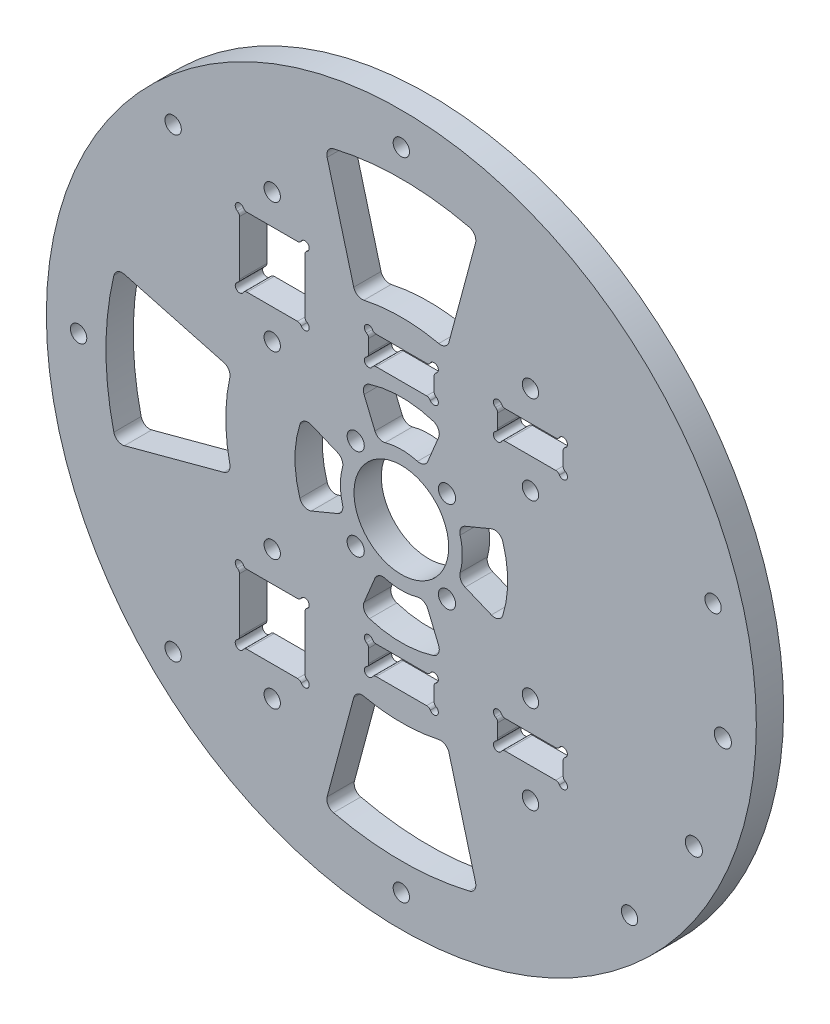
from build123d import *

# Parameters (mm, degrees)
SKETCH1_R                = 82.5
SKETCH1_R_2              = 1.89865
SKETCH1_R_3              = 1.9939
SKETCH1_R_4              = 11
BOSS_EXTRUDE1_DEPTH      = 6.35
SKETCH5_W                = 15.2
SKETCH5_H                = 16.075
CUT_EXTRUDE4_DEPTH       = 117.845293016
SKETCH6_R                = 1
CUT_EXTRUDE5_DEPTH       = 117.845293016
FILLET1_R                = 1
SKETCH10_W               = 52.512742007
SKETCH10_H               = 39.376351637
SKETCH10_W_2             = 54.285324016
SKETCH10_H_2             = 41.487938284
BOSS_EXTRUDE2_DEPTH      = 6.35
SKETCH11_W               = 15.2
SKETCH11_H               = 6.55
CUT_EXTRUDE8_DEPTH       = 117.845293016
SKETCH13_R               = 1
CUT_EXTRUDE9_DEPTH       = 117.845293016
FILLET2_R                = 1
LPATTERN3_COUNT          = 2
LPATTERN3_PITCH          = 30
FILLET2_OF_LPATTERN3_R   = 1
MIRROR3_DEPTH            = 6.35
SKETCH14_R               = 1.89865
CUT_EXTRUDE10_DEPTH      = 117.845293016
CUT_EXTRUDE11_DEPTH      = 10
FILLET3_R                = 2
CIRPATTERN1_COUNT        = 4
FILLET3_OF_CIRPATTERN1_R = 2
CUT_EXTRUDE12_DEPTH      = 117.845293016
FILLET4_R                = 2
CIRPATTERN2_COUNT        = 4
FILLET4_OF_CIRPATTERN2_R = 2
CUT_EXTRUDE13_START      = -3.571875
SKETCH17_R               = 4.7625
SKETCH17_R_2             = 1.89865
CUT_EXTRUDE13_DEPTH      = 3.571875


# Read off the part's stored shape, not the designer's step: Mirror3
with BuildPart() as part:
    # Sketch1 → Boss-Extrude1 (new body)
    with BuildSketch(Plane.XY):
        Circle(SKETCH1_R)
        with Locations((72.444436972, 19.411428383)):
            Circle(SKETCH1_R_2, mode=Mode.SUBTRACT)
        with Locations((74.714602357, -6.536680706)):
            Circle(SKETCH1_R_3, mode=Mode.SUBTRACT)
        Circle(SKETCH1_R_4, mode=Mode.SUBTRACT)
        with Locations((67.973084028, -31.696369631)):
            Circle(SKETCH1_R_3, mode=Mode.SUBTRACT)
        with Locations((10.606601718, -10.606601718)):
            Circle(SKETCH1_R_3, mode=Mode.SUBTRACT)
        with Locations((0, -75)):
            Circle(SKETCH1_R_2, mode=Mode.SUBTRACT)
        with Locations((-10.606601718, -10.606601718)):
            Circle(SKETCH1_R_3, mode=Mode.SUBTRACT)
        with Locations((-10.606601718, 10.606601718)):
            Circle(SKETCH1_R_3, mode=Mode.SUBTRACT)
        with Locations((10.606601718, 10.606601718)):
            Circle(SKETCH1_R_3, mode=Mode.SUBTRACT)
        with Locations((-53.033008589, -53.033008589)):
            Circle(SKETCH1_R_2, mode=Mode.SUBTRACT)
        with Locations((-75, 0)):
            Circle(SKETCH1_R_2, mode=Mode.SUBTRACT)
        with Locations((-53.033008589, 53.033008589)):
            Circle(SKETCH1_R_2, mode=Mode.SUBTRACT)
        with Locations((0, 75)):
            Circle(SKETCH1_R_2, mode=Mode.SUBTRACT)
        with Locations((53.033008589, -53.033008589)):
            Circle(SKETCH1_R_2, mode=Mode.SUBTRACT)
    extrude(amount=BOSS_EXTRUDE1_DEPTH)

    # Sketch5 → Cut-Extrude4 (cut, through all)
    with BuildSketch(Plane.XY.offset(6.35)):
        with Locations((-30, -35.9375)):
            Rectangle(SKETCH5_W, SKETCH5_H)
        with Locations((-30, 35.9375)):
            Rectangle(SKETCH5_W, SKETCH5_H)
        with Locations((30, 35.9375)):
            Rectangle(SKETCH5_W, SKETCH5_H)
        with Locations((0, -35.9375)):
            Rectangle(SKETCH5_W, SKETCH5_H)
        with Locations((30, -35.9375)):
            Rectangle(SKETCH5_W, SKETCH5_H)
        with Locations((0, 35.9375)):
            Rectangle(SKETCH5_W, SKETCH5_H)
    extrude(amount=-CUT_EXTRUDE4_DEPTH, mode=Mode.SUBTRACT)

    # Sketch6 → Cut-Extrude5 (cut, through all)
    with BuildSketch(Plane.XY.offset(6.35)):
        with Locations((-37.6, 43.975)):
            Circle(SKETCH6_R)
        with Locations((-22.4, 43.975)):
            Circle(SKETCH6_R)
        with Locations((-37.6, 27.9)):
            Circle(SKETCH6_R)
        with Locations((-22.4, 27.9)):
            Circle(SKETCH6_R)
        with Locations((-7.6, 43.975)):
            Circle(SKETCH6_R)
        with Locations((7.6, 43.975)):
            Circle(SKETCH6_R)
        with Locations((-7.6, 27.9)):
            Circle(SKETCH6_R)
        with Locations((7.6, 27.9)):
            Circle(SKETCH6_R)
        with Locations((22.4, 43.975)):
            Circle(SKETCH6_R)
        with Locations((37.6, 43.975)):
            Circle(SKETCH6_R)
        with Locations((22.4, 27.9)):
            Circle(SKETCH6_R)
        with Locations((37.6, 27.9)):
            Circle(SKETCH6_R)
        with Locations((-37.6, -27.9)):
            Circle(SKETCH6_R)
        with Locations((-22.4, -27.9)):
            Circle(SKETCH6_R)
        with Locations((-37.6, -43.975)):
            Circle(SKETCH6_R)
        with Locations((-22.4, -43.975)):
            Circle(SKETCH6_R)
        with Locations((-7.6, -27.9)):
            Circle(SKETCH6_R)
        with Locations((7.6, -27.9)):
            Circle(SKETCH6_R)
        with Locations((-7.6, -43.975)):
            Circle(SKETCH6_R)
        with Locations((7.6, -43.975)):
            Circle(SKETCH6_R)
        with Locations((22.4, -27.9)):
            Circle(SKETCH6_R)
        with Locations((37.6, -27.9)):
            Circle(SKETCH6_R)
        with Locations((22.4, -43.975)):
            Circle(SKETCH6_R)
        with Locations((37.6, -43.975)):
            Circle(SKETCH6_R)
    extrude(amount=-CUT_EXTRUDE5_DEPTH, mode=Mode.SUBTRACT)

    # Fillet1
    fillet1_edges = [part.edges().sort_by_distance(p)[0] for p in [
        (-37.6, 42.975, 3.175),
        (-36.6, 43.975, 3.175),
        (-22.4, 42.975, 3.175),
        (-23.4, 43.975, 3.175),
        (-37.6, 28.9, 3.175),
        (-36.6, 27.9, 3.175),
        (-23.4, 27.9, 3.175),
        (-22.4, 28.9, 3.175),
        (-7.6, 42.975, 3.175),
        (-6.6, 43.975, 3.175),
        (7.6, 42.975, 3.175),
        (6.6, 43.975, 3.175),
        (-7.6, 28.9, 3.175),
        (-6.6, 27.9, 3.175),
        (6.6, 27.9, 3.175),
        (7.6, 28.9, 3.175),
        (22.4, 42.975, 3.175),
        (23.4, 43.975, 3.175),
        (37.6, 42.975, 3.175),
        (36.6, 43.975, 3.175),
        (22.4, 28.9, 3.175),
        (23.4, 27.9, 3.175),
        (36.6, 27.9, 3.175),
        (37.6, 28.9, 3.175),
        (-36.6, -27.9, 3.175),
        (-37.6, -28.9, 3.175),
        (-22.4, -28.9, 3.175),
        (-23.4, -27.9, 3.175),
        (-36.6, -43.975, 3.175),
        (-37.6, -42.975, 3.175),
        (-23.4, -43.975, 3.175),
        (-22.4, -42.975, 3.175),
        (-6.6, -27.9, 3.175),
        (-7.6, -28.9, 3.175),
        (7.6, -28.9, 3.175),
        (6.6, -27.9, 3.175),
        (-6.6, -43.975, 3.175),
        (-7.6, -42.975, 3.175),
        (6.6, -43.975, 3.175),
        (7.6, -42.975, 3.175),
        (23.4, -27.9, 3.175),
        (22.4, -28.9, 3.175),
        (37.6, -28.9, 3.175),
        (36.6, -27.9, 3.175),
        (23.4, -43.975, 3.175),
        (22.4, -42.975, 3.175),
        (36.6, -43.975, 3.175),
        (37.6, -42.975, 3.175),
    ]]
    fillet(fillet1_edges, radius=FILLET1_R)

    # Sketch10 → Boss-Extrude2 (add, through all)
    with BuildSketch(Plane(origin=(0, 0, 0), x_dir=(-1, 0, 0), z_dir=(0, 0, -1))):
        with Locations((-14.291442444, 45.267678683)):
            Rectangle(SKETCH10_W, SKETCH10_H)
        with Locations((-15.177733449, -45.976574892)):
            Rectangle(SKETCH10_W_2, SKETCH10_H_2)
    extrude(amount=-BOSS_EXTRUDE2_DEPTH)

    # Sketch11 → Cut-Extrude8 (cut, through all)
    with BuildSketch(Plane(origin=(0, 0, 0), x_dir=(-1, 0, 0), z_dir=(0, 0, -1))):
        with Locations((0, 31.175)):
            Rectangle(SKETCH11_W, SKETCH11_H)
    cut_extrude8 = extrude(amount=-CUT_EXTRUDE8_DEPTH, mode=Mode.SUBTRACT)

    # Sketch13 → Cut-Extrude9 (cut, through all)
    with BuildSketch(Plane(origin=(0, 0, 0), x_dir=(-1, 0, 0), z_dir=(0, 0, -1))):
        with Locations((-7.6, 34.45)):
            Circle(SKETCH13_R)
        with Locations((-7.6, 27.9)):
            Circle(SKETCH13_R)
        with Locations((7.6, 27.9)):
            Circle(SKETCH13_R)
        with Locations((7.6, 34.45)):
            Circle(SKETCH13_R)
    cut_extrude9 = extrude(amount=-CUT_EXTRUDE9_DEPTH, mode=Mode.SUBTRACT)

    # Fillet2
    fillet2_edges = [part.edges().sort_by_distance(p)[0] for p in [
        (6.6, 34.45, 3.175),
        (7.6, 33.45, 3.175),
        (-6.6, 34.45, 3.175),
        (7.6, 28.9, 3.175),
        (-6.6, 27.9, 3.175),
        (6.6, 27.9, 3.175),
        (-7.6, 28.9, 3.175),
        (-7.6, 33.45, 3.175),
    ]]
    fillet(fillet2_edges, radius=FILLET2_R)

    # LPattern3: Cut-Extrude8, Cut-Extrude9 ×2
    with Locations(*[(i * LPATTERN3_PITCH, 0, 0) for i in range(1, LPATTERN3_COUNT)]):
        add(cut_extrude8, mode=Mode.SUBTRACT)
        add(cut_extrude9, mode=Mode.SUBTRACT)

    # Fillet2 of LPattern3
    fillet2_of_lpattern3_edges = [part.edges().sort_by_distance(p)[0] for p in [
        (36.6, 34.45, 3.175),
        (37.6, 33.45, 3.175),
        (23.4, 34.45, 3.175),
        (37.6, 28.9, 3.175),
        (23.4, 27.9, 3.175),
        (36.6, 27.9, 3.175),
        (22.4, 28.9, 3.175),
        (22.4, 33.45, 3.175),
    ]]
    fillet(fillet2_of_lpattern3_edges, radius=FILLET2_OF_LPATTERN3_R)

    # Mirror3 outline → Mirror3 (cut)
    with BuildSketch(Plane.XY):
        with BuildLine():
            Line((-5.867949192, -34.45), (5.867949192, -34.45))
            ThreePointArc((5.867949192, -34.45), (6.367949192, -34.583974596), (6.733974596, -34.95))
            ThreePointArc((6.733974596, -34.95), (8.307106781, -35.157106781), (8.1, -33.583974596))
            ThreePointArc((8.1, -33.583974596), (7.733974596, -33.217949192), (7.6, -32.717949192))
            Line((7.6, -32.717949192), (7.6, -29.632050808))
            ThreePointArc((7.6, -29.632050808), (7.733974596, -29.132050808), (8.1, -28.766025404))
            ThreePointArc((8.1, -28.766025404), (8.307106781, -27.192893219), (6.733974596, -27.4))
            ThreePointArc((6.733974596, -27.4), (6.367949192, -27.766025404), (5.867949192, -27.9))
            Line((5.867949192, -27.9), (-5.867949192, -27.9))
            ThreePointArc((-5.867949192, -27.9), (-6.367949192, -27.766025404), (-6.733974596, -27.4))
            ThreePointArc((-6.733974596, -27.4), (-8.307106781, -27.192893219), (-8.1, -28.766025404))
            ThreePointArc((-8.1, -28.766025404), (-7.733974596, -29.132050808), (-7.6, -29.632050808))
            Line((-7.6, -29.632050808), (-7.6, -32.717949192))
            ThreePointArc((-7.6, -32.717949192), (-7.733974596, -33.217949192), (-8.1, -33.583974596))
            ThreePointArc((-8.1, -33.583974596), (-8.307106781, -35.157106781), (-6.733974596, -34.95))
            ThreePointArc((-6.733974596, -34.95), (-6.367949192, -34.583974596), (-5.867949192, -34.45))
        make_face()
        with BuildLine():
            Line((24.132050808, -34.45), (35.867949192, -34.45))
            ThreePointArc((35.867949192, -34.45), (36.367949192, -34.583974596), (36.733974596, -34.95))
            ThreePointArc((36.733974596, -34.95), (38.307106781, -35.157106781), (38.1, -33.583974596))
            ThreePointArc((38.1, -33.583974596), (37.733974596, -33.217949192), (37.6, -32.717949192))
            Line((37.6, -32.717949192), (37.6, -29.632050808))
            ThreePointArc((37.6, -29.632050808), (37.733974596, -29.132050808), (38.1, -28.766025404))
            ThreePointArc((38.1, -28.766025404), (38.307106781, -27.192893219), (36.733974596, -27.4))
            ThreePointArc((36.733974596, -27.4), (36.367949192, -27.766025404), (35.867949192, -27.9))
            Line((35.867949192, -27.9), (24.132050808, -27.9))
            ThreePointArc((24.132050808, -27.9), (23.632050808, -27.766025404), (23.266025404, -27.4))
            ThreePointArc((23.266025404, -27.4), (21.692893219, -27.192893219), (21.9, -28.766025404))
            ThreePointArc((21.9, -28.766025404), (22.266025404, -29.132050808), (22.4, -29.632050808))
            Line((22.4, -29.632050808), (22.4, -32.717949192))
            ThreePointArc((22.4, -32.717949192), (22.266025404, -33.217949192), (21.9, -33.583974596))
            ThreePointArc((21.9, -33.583974596), (21.692893219, -35.157106781), (23.266025404, -34.95))
            ThreePointArc((23.266025404, -34.95), (23.632050808, -34.583974596), (24.132050808, -34.45))
        make_face()
    extrude(amount=MIRROR3_DEPTH, mode=Mode.SUBTRACT)

    # Sketch14 → Cut-Extrude10 (cut, through all)
    with BuildSketch(Plane.XY.offset(6.35)):
        with Locations((-30, 50.975)):
            Circle(SKETCH14_R)
        with Locations((-30, 20.9)):
            Circle(SKETCH14_R)
        with Locations((30, 41.45)):
            Circle(SKETCH14_R)
        with Locations((30, 20.9)):
            Circle(SKETCH14_R)
    cut_extrude10 = extrude(amount=-CUT_EXTRUDE10_DEPTH, mode=Mode.SUBTRACT)

    # Mirror4: Cut-Extrude10 across plane
    add(cut_extrude10.mirror(Plane.ZX), mode=Mode.SUBTRACT)

    # Sketch15 → Cut-Extrude11 (cut)
    with BuildSketch(Plane.XY.offset(6.35)):
        with BuildLine():
            Line((-9.461847865, 22.842921441), (-5.424537654, 13.095992373))
            ThreePointArc((-5.424537654, 13.095992373), (0, 14.175), (5.424537654, 13.095992373))
            Line((5.424537654, 13.095992373), (9.461847865, 22.842921441))
            ThreePointArc((9.461847865, 22.842921441), (0, 24.725), (-9.461847865, 22.842921441))
        make_face()
    cut_extrude11 = extrude(amount=-CUT_EXTRUDE11_DEPTH, mode=Mode.SUBTRACT)

    # Fillet3
    fillet3_edges = [part.edges().sort_by_distance(p)[0] for p in [
        (5.424537654, 13.095992373, 3.175),
        (-5.424537654, 13.095992373, 3.175),
        (-9.461847865, 22.842921441, 3.175),
        (9.461847865, 22.842921441, 3.175),
    ]]
    fillet(fillet3_edges, radius=FILLET3_R)

    # CirPattern1: Cut-Extrude11 ×4 about axis
    cirpattern1_axis = Axis((0, 0, 0), (0, 0, 1))
    for i in range(1, CIRPATTERN1_COUNT):
        add(cut_extrude11.rotate(cirpattern1_axis, i * 360 / CIRPATTERN1_COUNT), mode=Mode.SUBTRACT)

    # Fillet3 of CirPattern1
    fillet3_of_cirpattern1_edges = [part.edges().sort_by_distance(p)[0] for p in [
        (-13.095992373, 5.424537654, 3.175),
        (-13.095992373, -5.424537654, 3.175),
        (-22.842921441, -9.461847865, 3.175),
        (-22.842921441, 9.461847865, 3.175),
        (-5.424537654, -13.095992373, 3.175),
        (5.424537654, -13.095992373, 3.175),
        (9.461847865, -22.842921441, 3.175),
        (-9.461847865, -22.842921441, 3.175),
        (13.095992373, -5.424537654, 3.175),
        (13.095992373, 5.424537654, 3.175),
        (22.842921441, 9.461847865, 3.175),
        (22.842921441, -9.461847865, 3.175),
    ]]
    fillet(fillet3_of_cirpattern1_edges, radius=FILLET3_OF_CIRPATTERN1_R)

    # Sketch16 → Cut-Extrude12 (cut, through all)
    with BuildSketch(Plane.XY.offset(6.35)):
        with BuildLine():
            Line((17.767927446, -66.310807975), (10.55981704, -39.409773713))
            ThreePointArc((10.55981704, -39.409773713), (0, -40.8), (-10.55981704, -39.409773713))
            Line((-10.55981704, -39.409773713), (-17.767927446, -66.310807975))
            ThreePointArc((-17.767927446, -66.310807975), (0, -68.65), (17.767927446, -66.310807975))
        make_face()
    cut_extrude12 = extrude(amount=-CUT_EXTRUDE12_DEPTH, mode=Mode.SUBTRACT)

    # Fillet4
    fillet4_edges = [part.edges().sort_by_distance(p)[0] for p in [
        (-10.55981704, -39.409773713, 3.175),
        (10.55981704, -39.409773713, 3.175),
        (17.767927446, -66.310807975, 3.175),
        (-17.767927446, -66.310807975, 3.175),
    ]]
    fillet(fillet4_edges, radius=FILLET4_R)

    # CirPattern2: Cut-Extrude12 ×4 about axis, 1 skipped
    cirpattern2_axis = Axis((0, 0, 0), (0, 0, -1))
    add([cut_extrude12.rotate(cirpattern2_axis, i * 360 / CIRPATTERN2_COUNT) for i in range(1, CIRPATTERN2_COUNT) if i not in (3,)], mode=Mode.SUBTRACT)

    # Fillet4 of CirPattern2
    fillet4_of_cirpattern2_edges = [part.edges().sort_by_distance(p)[0] for p in [
        (-39.409773713, 10.55981704, 3.175),
        (-39.409773713, -10.55981704, 3.175),
        (-66.310807975, -17.767927446, 3.175),
        (-66.310807975, 17.767927446, 3.175),
        (10.55981704, 39.409773713, 3.175),
        (-10.55981704, 39.409773713, 3.175),
        (-17.767927446, 66.310807975, 3.175),
        (17.767927446, 66.310807975, 3.175),
    ]]
    fillet(fillet4_of_cirpattern2_edges, radius=FILLET4_OF_CIRPATTERN2_R)

    # Sketch17 → Cut-Extrude13 (cut)
    # profile 1 of 8: a face of its own
    with BuildSketch(Plane(origin=(0, 0, 0), x_dir=(-1, 0, 0), z_dir=(0, 0, -1)).offset(CUT_EXTRUDE13_START)):
        with Locations((30, -50.975)):
            Circle(SKETCH17_R)
        with Locations(Location((30, -50.975, 0), (0, 0, 180))):
            Circle(SKETCH17_R_2, mode=Mode.SUBTRACT)
    # profile 2 of 8: a face of its own
    with BuildSketch(Plane(origin=(0, 0, 0), x_dir=(-1, 0, 0), z_dir=(0, 0, -1)).offset(CUT_EXTRUDE13_START)):
        with Locations((30, -20.9)):
            Circle(SKETCH17_R)
        with Locations(Location((30, -20.9, 0), (0, 0, 180))):
            Circle(SKETCH17_R_2, mode=Mode.SUBTRACT)
    # profile 3 of 8: a face of its own
    with BuildSketch(Plane(origin=(0, 0, 0), x_dir=(-1, 0, 0), z_dir=(0, 0, -1)).offset(CUT_EXTRUDE13_START)):
        with Locations((-30, -41.45)):
            Circle(SKETCH17_R)
        with Locations(Location((-30, -41.45, 0), (0, 0, 180))):
            Circle(SKETCH17_R_2, mode=Mode.SUBTRACT)
    # profile 4 of 8: a face of its own
    with BuildSketch(Plane(origin=(0, 0, 0), x_dir=(-1, 0, 0), z_dir=(0, 0, -1)).offset(CUT_EXTRUDE13_START)):
        with Locations((-30, -20.9)):
            Circle(SKETCH17_R)
        with Locations(Location((-30, -20.9, 0), (0, 0, 180))):
            Circle(SKETCH17_R_2, mode=Mode.SUBTRACT)
    # profile 5 of 8: a face of its own
    with BuildSketch(Plane(origin=(0, 0, 0), x_dir=(-1, 0, 0), z_dir=(0, 0, -1)).offset(CUT_EXTRUDE13_START)):
        with Locations((-30, 20.9)):
            Circle(SKETCH17_R)
        with Locations(Location((-30, 20.9, 0), (0, 0, 180))):
            Circle(SKETCH17_R_2, mode=Mode.SUBTRACT)
    # profile 6 of 8: a face of its own
    with BuildSketch(Plane(origin=(0, 0, 0), x_dir=(-1, 0, 0), z_dir=(0, 0, -1)).offset(CUT_EXTRUDE13_START)):
        with Locations((-30, 41.45)):
            Circle(SKETCH17_R)
        with Locations(Location((-30, 41.45, 0), (0, 0, 180))):
            Circle(SKETCH17_R_2, mode=Mode.SUBTRACT)
    # profile 7 of 8: a face of its own
    with BuildSketch(Plane(origin=(0, 0, 0), x_dir=(-1, 0, 0), z_dir=(0, 0, -1)).offset(CUT_EXTRUDE13_START)):
        with Locations((30, 50.975)):
            Circle(SKETCH17_R)
        with Locations(Location((30, 50.975, 0), (0, 0, 180))):
            Circle(SKETCH17_R_2, mode=Mode.SUBTRACT)
    # profile 8 of 8: a face of its own
    with BuildSketch(Plane(origin=(0, 0, 0), x_dir=(-1, 0, 0), z_dir=(0, 0, -1)).offset(CUT_EXTRUDE13_START)):
        with Locations((30, 20.9)):
            Circle(SKETCH17_R)
        with Locations(Location((30, 20.9, 0), (0, 0, 180))):
            Circle(SKETCH17_R_2, mode=Mode.SUBTRACT)
    extrude(amount=CUT_EXTRUDE13_DEPTH, mode=Mode.SUBTRACT)


solid = part.part
